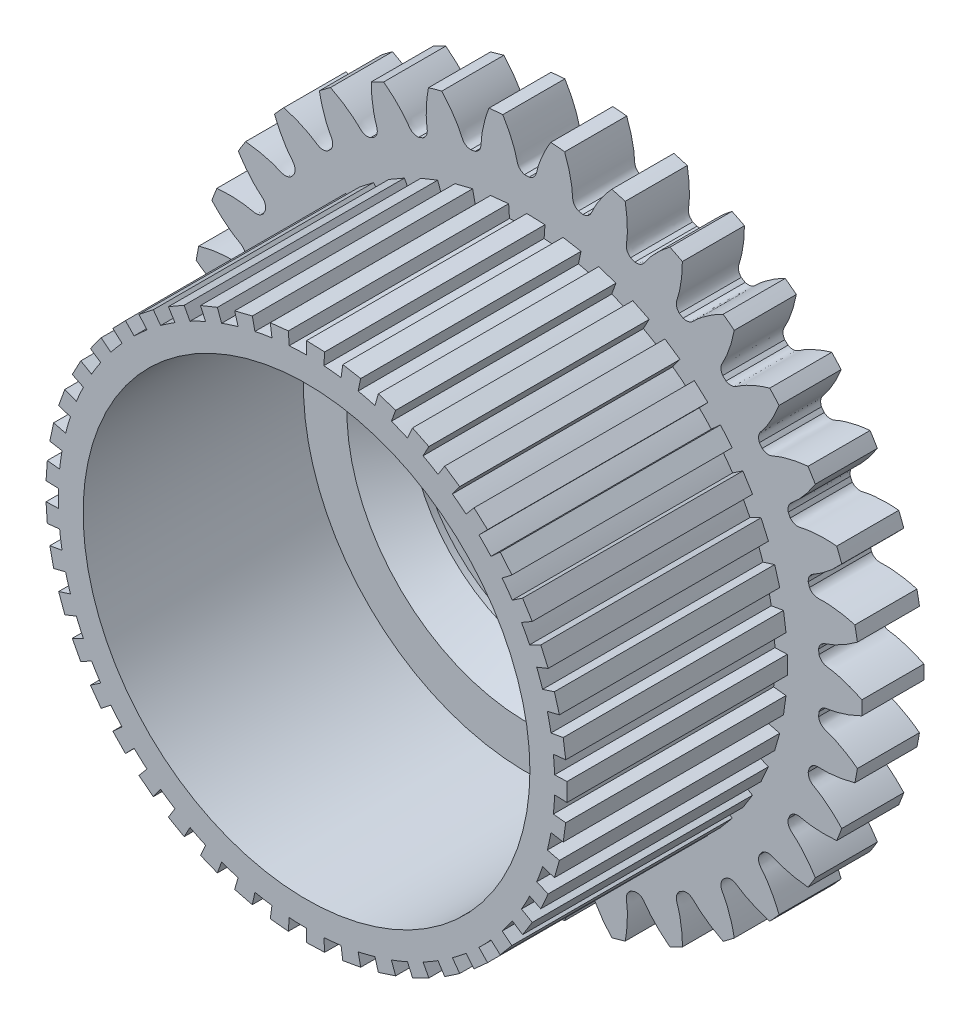
from build123d import *

# Parameters (mm, degrees)
SKETCH_1_R               = 27
EXTRUDE_1_DEPTH          = 5
CUT_EXTRUDE_1_DEPTH      = 39.509739028
PATTERN_CIRCULAR_1_COUNT = 34
SKETCH_4_R               = 12
SKETCH_4_R_2             = 4.5
SKETCH_4_R_3             = 3.25
CUT_EXTRUDE_2_DEPTH      = 3
CHAMFER_1_SIZE           = 2.5
SKETCH_6_R               = 3.25
CUT_EXTRUDE_3_DEPTH      = 39.252654908
SKETCH_7_R               = 18
EXTRUDE_2_DEPTH          = 17.75
SKETCH_8_R               = 4.5
CUT_EXTRUDE_4_DEPTH      = 2.5


with BuildPart() as part:
    # 草图1 → 凸台-拉伸1 (new body)
    with BuildSketch(Plane.XY):
        Circle(SKETCH_1_R)
    extrude(amount=EXTRUDE_1_DEPTH)

    # 草图2 → 切除-拉伸1 (cut, through all)
    with BuildSketch(Plane.XY):
        with BuildLine():
            ThreePointArc((0.183171175, 23.624289901), (0, 23.625), (-0.183171175, 23.624289901))
            add(Edge.make_bspline(
                [(-0.183171175, 23.624289901), (-0.716587806, 23.775112896), (-0.763410395, 24.188787315), (-0.879946356, 24.623629896), (-0.912930358, 24.738245821), (-0.951084244, 24.861314333), (-0.99469329, 24.992699977), (-1.044123655, 25.132221413), (-1.099711127, 25.279697341), (-1.161793992, 25.434932943), (-1.230702926, 25.597724076), (-1.306763614, 25.76785621), (-1.390295632, 25.945104927), (-1.481612426, 26.129235971), (-1.581020975, 26.320005435), (-1.688821555, 26.51715992), (-1.805307471, 26.720436707), (-1.930764813, 26.929563939), (-2.065472203, 27.144260803), (-2.209700557, 27.364237722), (-2.36371284, 27.589196551), (-2.527763841, 27.818830783), (-2.702099938, 28.052825758), (-2.886958877, 28.290858874), (-3.082569553, 28.532599812), (-3.289151799, 28.777710761), (-3.506916179, 29.025846649), (-3.73606378, 29.276655378), (-3.97678604, 29.52977807), (-4.229264468, 29.784849315), (-4.586391615, 30.131497572), (-4.865591808, 30.386500811), (-5.057363345, 30.554916542)],
                knots=[0, 0, 0, 0, 0.13072362, 0.143503881, 0.157401081, 0.17241522, 0.188546299, 0.205794316, 0.224159273, 0.243641169, 0.264240005, 0.285955779, 0.308788493, 0.332738146, 0.357804738, 0.383988269, 0.411288739, 0.439706149, 0.469240498, 0.499891786, 0.531660014, 0.56454518, 0.598547286, 0.633666331, 0.669902315, 0.707255238, 0.745725101, 0.785311903, 0.826015644, 0.867836324, 0.910773943, 1, 1, 1, 1], degree=3))
            ThreePointArc((-5.057363345, 30.554916542), (0, 30.970628811), (5.057363345, 30.554916542))
            add(Edge.make_bspline(
                [(0.183171175, 23.624289901), (0.716587806, 23.775112896), (0.763410395, 24.188787315), (0.879946356, 24.623629896), (0.912930358, 24.738245821), (0.951084244, 24.861314333), (0.99469329, 24.992699977), (1.044123655, 25.132221413), (1.099711127, 25.279697341), (1.161793992, 25.434932943), (1.230702926, 25.597724076), (1.306763614, 25.76785621), (1.390295632, 25.945104927), (1.481612426, 26.129235971), (1.581020975, 26.320005435), (1.688821555, 26.51715992), (1.805307471, 26.720436707), (1.930764813, 26.929563939), (2.065472203, 27.144260803), (2.209700557, 27.364237722), (2.36371284, 27.589196551), (2.527763841, 27.818830783), (2.702099938, 28.052825758), (2.886958877, 28.290858874), (3.082569553, 28.532599812), (3.289151799, 28.777710761), (3.506916179, 29.025846649), (3.73606378, 29.276655378), (3.97678604, 29.52977807), (4.229264468, 29.784849315), (4.586391615, 30.131497572), (4.865591808, 30.386500811), (5.057363345, 30.554916542)],
                knots=[0, 0, 0, 0, 0.13072362, 0.143503881, 0.157401081, 0.17241522, 0.188546299, 0.205794316, 0.224159273, 0.243641169, 0.264240005, 0.285955779, 0.308788493, 0.332738146, 0.357804738, 0.383988269, 0.411288739, 0.439706149, 0.469240498, 0.499891786, 0.531660014, 0.56454518, 0.598547286, 0.633666331, 0.669902315, 0.707255238, 0.745725101, 0.785311903, 0.826015644, 0.867836324, 0.910773943, 1, 1, 1, 1], degree=3))
        make_face()
    cut_extrude_1 = extrude(amount=CUT_EXTRUDE_1_DEPTH, mode=Mode.SUBTRACT)

    # 阵列(圆周)1: 切除-拉伸1 ×34 about axis
    pattern_circular_1_axis = Axis((0, 0, -1.5), (0, 0, 1))
    for i in range(1, PATTERN_CIRCULAR_1_COUNT):
        add(cut_extrude_1.rotate(pattern_circular_1_axis, i * 360 / PATTERN_CIRCULAR_1_COUNT), mode=Mode.SUBTRACT)

    # 草图4 → 切除-拉伸2 (cut)
    # profile 1 of 2: a face of its own
    with BuildSketch(Plane.XY.offset(5)):
        Circle(SKETCH_4_R)
        Circle(SKETCH_4_R_2, mode=Mode.SUBTRACT)
    # profile 2 of 2: a face of its own
    with BuildSketch(Plane.XY.offset(5)):
        Circle(SKETCH_4_R_3)
    extrude(amount=-CUT_EXTRUDE_2_DEPTH, mode=Mode.SUBTRACT)

    # 倒角1
    chamfer_1_edges = [part.edges().sort_by_distance(p)[0] for p in [
        (-12, 0, 5),
    ]]
    chamfer(chamfer_1_edges, length=CHAMFER_1_SIZE)

    # 草图6 → 切除-拉伸3 (cut, through all)
    with BuildSketch(Plane.XY.offset(2)):
        Circle(SKETCH_6_R)
    extrude(amount=-CUT_EXTRUDE_3_DEPTH, mode=Mode.SUBTRACT)

    # 草图7 → 凸台-拉伸2 (add)
    with BuildSketch(Plane.XY.offset(5)):
        with BuildLine():
            ThreePointArc((2.783462019, 19.805361375), (2.090569265, 19.890437907), (1.395129475, 19.951281005))
            Line((1.395129475, 19.951281005), (1.464885949, 20.948845055))
            Line((1.464885949, 20.948845055), (0, 21))
            Line((0, 21), (0, 20))
            ThreePointArc((0, 20), (-0.697989934, 19.98781654), (-1.395129475, 19.951281005))
            Line((-1.395129475, 19.951281005), (-1.464885949, 20.948845055))
            Line((-1.464885949, 20.948845055), (-2.92263512, 20.795629444))
            Line((-2.92263512, 20.795629444), (-2.783462019, 19.805361375))
            ThreePointArc((-2.783462019, 19.805361375), (-3.472963553, 19.69615506), (-4.158233816, 19.562952015))
            Line((-4.158233816, 19.562952015), (-4.366145507, 20.541099615))
            Line((-4.366145507, 20.541099615), (-5.788384472, 20.186495615))
            Line((-5.788384472, 20.186495615), (-5.512747116, 19.225233919))
            ThreePointArc((-5.512747116, 19.225233919), (-6.180339887, 19.021130326), (-6.840402867, 18.793852416))
            Line((-6.840402867, 18.793852416), (-7.18242301, 19.733545037))
            Line((-7.18242301, 19.733545037), (-8.541469505, 19.18445461))
            Line((-8.541469505, 19.18445461), (-8.134732862, 18.270909153))
            ThreePointArc((-8.134732862, 18.270909153), (-8.767422936, 17.975880926), (-9.389431256, 17.658951857))
            Line((-9.389431256, 17.658951857), (-9.858902819, 18.54189945))
            Line((-9.858902819, 18.54189945), (-11.128304549, 17.809010019))
            Line((-11.128304549, 17.809010019), (-10.598385285, 16.960961923))
            ThreePointArc((-10.598385285, 16.960961923), (-11.183858069, 16.580751451), (-11.755705046, 16.180339887))
            Line((-11.755705046, 16.180339887), (-12.343490298, 16.989356882))
            Line((-12.343490298, 16.989356882), (-13.498539803, 16.086933305))
            Line((-13.498539803, 16.086933305), (-12.855752194, 15.320888862))
            ThreePointArc((-12.855752194, 15.320888862), (-13.382612127, 14.86289651), (-13.893167409, 14.386796007))
            Line((-13.893167409, 14.386796007), (-14.58782578, 15.106135807))
            Line((-14.58782578, 15.106135807), (-15.606041335, 14.051742734))
            Line((-15.606041335, 14.051742734), (-14.86289651, 13.382612127))
            ThreePointArc((-14.86289651, 13.382612127), (-15.320888862, 12.855752194), (-15.760215072, 12.313229507))
            Line((-15.760215072, 12.313229507), (-16.548225826, 12.928890982))
            Line((-16.548225826, 12.928890982), (-17.409789024, 11.743050973))
            Line((-17.409789024, 11.743050973), (-16.580751451, 11.183858069))
            ThreePointArc((-16.580751451, 11.183858069), (-16.960961923, 10.598385285), (-17.320508076, 10))
            Line((-17.320508076, 10), (-18.186533479, 10.5))
            Line((-18.186533479, 10.5), (-18.874674972, 9.205794083))
            Line((-18.874674972, 9.205794083), (-17.975880926, 8.767422936))
            ThreePointArc((-17.975880926, 8.767422936), (-18.270909153, 8.134732862), (-18.543677091, 7.492131868))
            Line((-18.543677091, 7.492131868), (-19.470860946, 7.866738462))
            Line((-19.470860946, 7.866738462), (-19.972186842, 6.489356882))
            Line((-19.972186842, 6.489356882), (-19.021130326, 6.180339887))
            ThreePointArc((-19.021130326, 6.180339887), (-19.225233919, 5.512747116), (-19.405914526, 4.838437912))
            Line((-19.405914526, 4.838437912), (-20.376210252, 5.080359808))
            Line((-20.376210252, 5.080359808), (-20.680962813, 3.646611731))
            Line((-20.680962813, 3.646611731), (-19.69615506, 3.472963553))
            ThreePointArc((-19.69615506, 3.472963553), (-19.805361375, 2.783462019), (-19.890437907, 2.090569265))
            Line((-19.890437907, 2.090569265), (-20.884959803, 2.195097729))
            Line((-20.884959803, 2.195097729), (-20.987207367, 0.732889431))
            Line((-20.987207367, 0.732889431), (-19.98781654, 0.697989934))
            ThreePointArc((-19.98781654, 0.697989934), (-20, 0), (-19.98781654, -0.697989934))
            Line((-19.98781654, -0.697989934), (-20.987207367, -0.732889431))
            Line((-20.987207367, -0.732889431), (-20.884959803, -2.195097729))
            Line((-20.884959803, -2.195097729), (-19.890437907, -2.090569265))
            ThreePointArc((-19.890437907, -2.090569265), (-19.805361375, -2.783462019), (-19.69615506, -3.472963553))
            Line((-19.69615506, -3.472963553), (-20.680962813, -3.646611731))
            Line((-20.680962813, -3.646611731), (-20.376210252, -5.080359808))
            Line((-20.376210252, -5.080359808), (-19.405914526, -4.838437912))
            ThreePointArc((-19.405914526, -4.838437912), (-19.225233919, -5.512747116), (-19.021130326, -6.180339887))
            Line((-19.021130326, -6.180339887), (-19.972186842, -6.489356882))
            Line((-19.972186842, -6.489356882), (-19.470860946, -7.866738462))
            Line((-19.470860946, -7.866738462), (-18.543677091, -7.492131868))
            ThreePointArc((-18.543677091, -7.492131868), (-18.270909153, -8.134732862), (-17.975880926, -8.767422936))
            Line((-17.975880926, -8.767422936), (-18.874674972, -9.205794083))
            Line((-18.874674972, -9.205794083), (-18.186533479, -10.5))
            Line((-18.186533479, -10.5), (-17.320508076, -10))
            ThreePointArc((-17.320508076, -10), (-16.960961923, -10.598385285), (-16.580751451, -11.183858069))
            Line((-16.580751451, -11.183858069), (-17.409789024, -11.743050973))
            Line((-17.409789024, -11.743050973), (-16.548225826, -12.928890982))
            Line((-16.548225826, -12.928890982), (-15.760215072, -12.313229507))
            ThreePointArc((-15.760215072, -12.313229507), (-15.320888862, -12.855752194), (-14.86289651, -13.382612127))
            Line((-14.86289651, -13.382612127), (-15.606041335, -14.051742734))
            Line((-15.606041335, -14.051742734), (-14.58782578, -15.106135807))
            Line((-14.58782578, -15.106135807), (-13.893167409, -14.386796007))
            ThreePointArc((-13.893167409, -14.386796007), (-13.382612127, -14.86289651), (-12.855752194, -15.320888862))
            Line((-12.855752194, -15.320888862), (-13.498539803, -16.086933305))
            Line((-13.498539803, -16.086933305), (-12.343490298, -16.989356882))
            Line((-12.343490298, -16.989356882), (-11.755705046, -16.180339887))
            ThreePointArc((-11.755705046, -16.180339887), (-11.183858069, -16.580751451), (-10.598385285, -16.960961923))
            Line((-10.598385285, -16.960961923), (-11.128304549, -17.809010019))
            Line((-11.128304549, -17.809010019), (-9.858902819, -18.54189945))
            Line((-9.858902819, -18.54189945), (-9.389431256, -17.658951857))
            ThreePointArc((-9.389431256, -17.658951857), (-8.767422936, -17.975880926), (-8.134732862, -18.270909153))
            Line((-8.134732862, -18.270909153), (-8.541469505, -19.18445461))
            Line((-8.541469505, -19.18445461), (-7.18242301, -19.733545037))
            Line((-7.18242301, -19.733545037), (-6.840402867, -18.793852416))
            ThreePointArc((-6.840402867, -18.793852416), (-6.180339887, -19.021130326), (-5.512747116, -19.225233919))
            Line((-5.512747116, -19.225233919), (-5.788384472, -20.186495615))
            Line((-5.788384472, -20.186495615), (-4.366145507, -20.541099615))
            Line((-4.366145507, -20.541099615), (-4.158233816, -19.562952015))
            ThreePointArc((-4.158233816, -19.562952015), (-3.472963553, -19.69615506), (-2.783462019, -19.805361375))
            Line((-2.783462019, -19.805361375), (-2.92263512, -20.795629444))
            Line((-2.92263512, -20.795629444), (-1.464885949, -20.948845055))
            Line((-1.464885949, -20.948845055), (-1.395129475, -19.951281005))
            ThreePointArc((-1.395129475, -19.951281005), (-0.697989934, -19.98781654), (0, -20))
            Line((0, -20), (0, -21))
            Line((0, -21), (1.464885949, -20.948845055))
            Line((1.464885949, -20.948845055), (1.395129475, -19.951281005))
            ThreePointArc((1.395129475, -19.951281005), (2.090569265, -19.890437907), (2.783462019, -19.805361375))
            Line((2.783462019, -19.805361375), (2.92263512, -20.795629444))
            Line((2.92263512, -20.795629444), (4.366145507, -20.541099615))
            Line((4.366145507, -20.541099615), (4.158233816, -19.562952015))
            ThreePointArc((4.158233816, -19.562952015), (4.838437912, -19.405914526), (5.512747116, -19.225233919))
            Line((5.512747116, -19.225233919), (5.788384472, -20.186495615))
            Line((5.788384472, -20.186495615), (7.18242301, -19.733545037))
            Line((7.18242301, -19.733545037), (6.840402867, -18.793852416))
            ThreePointArc((6.840402867, -18.793852416), (7.492131868, -18.543677091), (8.134732862, -18.270909153))
            Line((8.134732862, -18.270909153), (8.541469505, -19.18445461))
            Line((8.541469505, -19.18445461), (9.858902819, -18.54189945))
            Line((9.858902819, -18.54189945), (9.389431256, -17.658951857))
            ThreePointArc((9.389431256, -17.658951857), (10, -17.320508076), (10.598385285, -16.960961923))
            Line((10.598385285, -16.960961923), (11.128304549, -17.809010019))
            Line((11.128304549, -17.809010019), (12.343490298, -16.989356882))
            Line((12.343490298, -16.989356882), (11.755705046, -16.180339887))
            ThreePointArc((11.755705046, -16.180339887), (12.313229507, -15.760215072), (12.855752194, -15.320888862))
            Line((12.855752194, -15.320888862), (13.498539803, -16.086933305))
            Line((13.498539803, -16.086933305), (14.58782578, -15.106135807))
            Line((14.58782578, -15.106135807), (13.893167409, -14.386796007))
            ThreePointArc((13.893167409, -14.386796007), (14.386796007, -13.893167409), (14.86289651, -13.382612127))
            Line((14.86289651, -13.382612127), (15.606041335, -14.051742734))
            Line((15.606041335, -14.051742734), (16.548225826, -12.928890982))
            Line((16.548225826, -12.928890982), (15.760215072, -12.313229507))
            ThreePointArc((15.760215072, -12.313229507), (16.180339887, -11.755705046), (16.580751451, -11.183858069))
            Line((16.580751451, -11.183858069), (17.409789024, -11.743050973))
            Line((17.409789024, -11.743050973), (18.186533479, -10.5))
            Line((18.186533479, -10.5), (17.320508076, -10))
            ThreePointArc((17.320508076, -10), (17.658951857, -9.389431256), (17.975880926, -8.767422936))
            Line((17.975880926, -8.767422936), (18.874674972, -9.205794083))
            Line((18.874674972, -9.205794083), (19.470860946, -7.866738462))
            Line((19.470860946, -7.866738462), (18.543677091, -7.492131868))
            ThreePointArc((18.543677091, -7.492131868), (18.793852416, -6.840402867), (19.021130326, -6.180339887))
            Line((19.021130326, -6.180339887), (19.972186842, -6.489356882))
            Line((19.972186842, -6.489356882), (20.376210252, -5.080359808))
            Line((20.376210252, -5.080359808), (19.405914526, -4.838437912))
            ThreePointArc((19.405914526, -4.838437912), (19.562952015, -4.158233816), (19.69615506, -3.472963553))
            Line((19.69615506, -3.472963553), (20.680962813, -3.646611731))
            Line((20.680962813, -3.646611731), (20.884959803, -2.195097729))
            Line((20.884959803, -2.195097729), (19.890437907, -2.090569265))
            ThreePointArc((19.890437907, -2.090569265), (19.951281005, -1.395129475), (19.98781654, -0.697989934))
            Line((19.98781654, -0.697989934), (20.987207367, -0.732889431))
            Line((20.987207367, -0.732889431), (20.987207367, 0.732889431))
            Line((20.987207367, 0.732889431), (19.98781654, 0.697989934))
            ThreePointArc((19.98781654, 0.697989934), (19.951281005, 1.395129475), (19.890437907, 2.090569265))
            Line((19.890437907, 2.090569265), (20.884959803, 2.195097729))
            Line((20.884959803, 2.195097729), (20.680962813, 3.646611731))
            Line((20.680962813, 3.646611731), (19.69615506, 3.472963553))
            ThreePointArc((19.69615506, 3.472963553), (19.562952015, 4.158233816), (19.405914526, 4.838437912))
            Line((19.405914526, 4.838437912), (20.376210252, 5.080359808))
            Line((20.376210252, 5.080359808), (19.972186842, 6.489356882))
            Line((19.972186842, 6.489356882), (19.021130326, 6.180339887))
            ThreePointArc((19.021130326, 6.180339887), (18.793852416, 6.840402867), (18.543677091, 7.492131868))
            Line((18.543677091, 7.492131868), (19.470860946, 7.866738462))
            Line((19.470860946, 7.866738462), (18.874674972, 9.205794083))
            Line((18.874674972, 9.205794083), (17.975880926, 8.767422936))
            ThreePointArc((17.975880926, 8.767422936), (17.658951857, 9.389431256), (17.320508076, 10))
            Line((17.320508076, 10), (18.186533479, 10.5))
            Line((18.186533479, 10.5), (17.409789024, 11.743050973))
            Line((17.409789024, 11.743050973), (16.580751451, 11.183858069))
            ThreePointArc((16.580751451, 11.183858069), (16.180339887, 11.755705046), (15.760215072, 12.313229507))
            Line((15.760215072, 12.313229507), (16.548225826, 12.928890982))
            Line((16.548225826, 12.928890982), (15.606041335, 14.051742734))
            Line((15.606041335, 14.051742734), (14.86289651, 13.382612127))
            ThreePointArc((14.86289651, 13.382612127), (14.386796007, 13.893167409), (13.893167409, 14.386796007))
            Line((13.893167409, 14.386796007), (14.58782578, 15.106135807))
            Line((14.58782578, 15.106135807), (13.498539803, 16.086933305))
            Line((13.498539803, 16.086933305), (12.855752194, 15.320888862))
            ThreePointArc((12.855752194, 15.320888862), (12.313229507, 15.760215072), (11.755705046, 16.180339887))
            Line((11.755705046, 16.180339887), (12.343490298, 16.989356882))
            Line((12.343490298, 16.989356882), (11.128304549, 17.809010019))
            Line((11.128304549, 17.809010019), (10.598385285, 16.960961923))
            ThreePointArc((10.598385285, 16.960961923), (10, 17.320508076), (9.389431256, 17.658951857))
            Line((9.389431256, 17.658951857), (9.858902819, 18.54189945))
            Line((9.858902819, 18.54189945), (8.541469505, 19.18445461))
            Line((8.541469505, 19.18445461), (8.134732862, 18.270909153))
            ThreePointArc((8.134732862, 18.270909153), (7.492131868, 18.543677091), (6.840402867, 18.793852416))
            Line((6.840402867, 18.793852416), (7.18242301, 19.733545037))
            Line((7.18242301, 19.733545037), (5.788384472, 20.186495615))
            Line((5.788384472, 20.186495615), (5.512747116, 19.225233919))
            ThreePointArc((5.512747116, 19.225233919), (4.838437912, 19.405914526), (4.158233816, 19.562952015))
            Line((4.158233816, 19.562952015), (4.366145507, 20.541099615))
            Line((4.366145507, 20.541099615), (2.92263512, 20.795629444))
            Line((2.92263512, 20.795629444), (2.783462019, 19.805361375))
        make_face()
        Circle(SKETCH_7_R, mode=Mode.SUBTRACT)
    extrude(amount=EXTRUDE_2_DEPTH)

    # 草图8 → 切除-拉伸4 (cut)
    with BuildSketch(Plane.XY.offset(5)):
        Circle(SKETCH_8_R)
    extrude(amount=-CUT_EXTRUDE_4_DEPTH, mode=Mode.SUBTRACT)


solid = part.part
